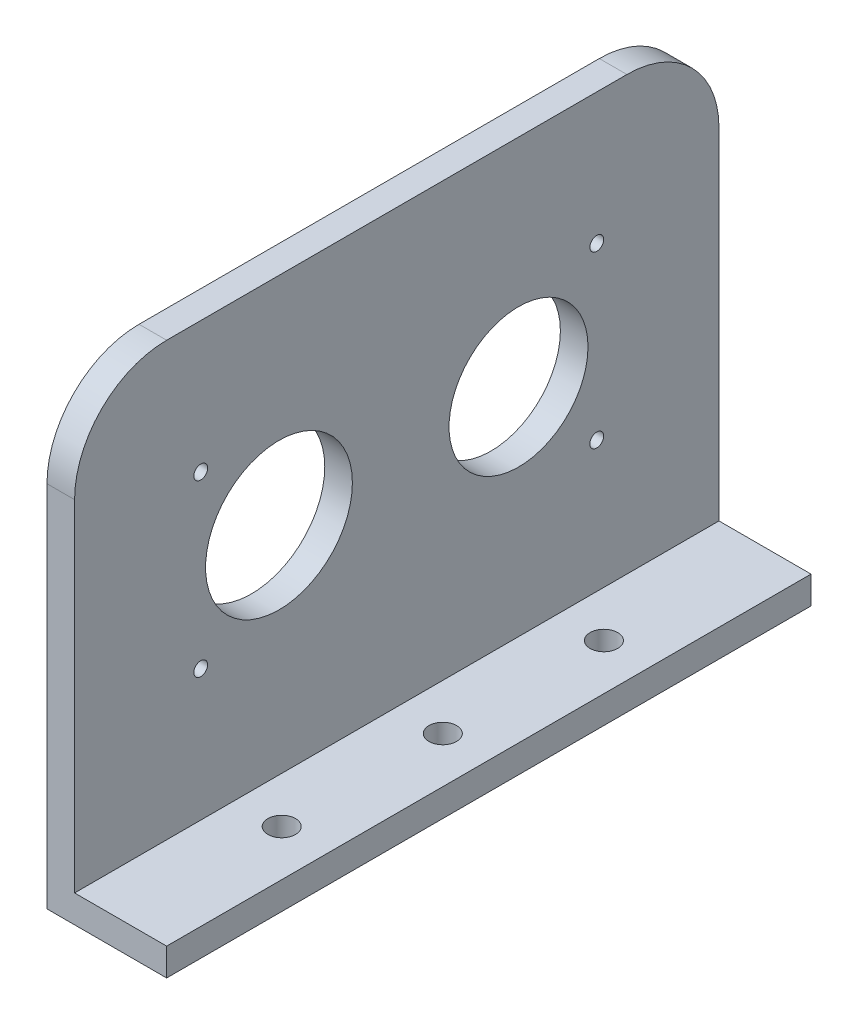
from build123d import *

# Parameters (mm, degrees)
BOSS_EXTRUDE1_DEPTH = 70
SKETCH2_R           = 7.975
CUT_EXTRUDE9_DEPTH  = 87.602540378
SKETCH2_12_R        = 7.5475
CUT_EXTRUDE10_DEPTH = 87.602540378
FILLET1_R           = 10
FILLET2_R           = 10
SKETCH3_R           = 1.5
CUT_EXTRUDE11_DEPTH = 86.311195045
SKETCH4_R           = 0.75
CUT_EXTRUDE12_DEPTH = 88


with BuildPart() as part:
    # Sketch1 → Boss-Extrude1 (new body)
    with BuildSketch(Plane.XY):
        Polygon((0, 0), (0, 3), (-10, 3), (-10, 50), (-13, 50), (-13, 0), align=None)
    extrude(amount=BOSS_EXTRUDE1_DEPTH)

    # Sketch2 → Cut-Extrude9 (cut, through all)
    with BuildSketch(Plane(origin=(-10, 0, 0), x_dir=(0, 0, -1), z_dir=(1, 0, 0))):
        with Locations((-47.7975, 26.5)):
            Circle(SKETCH2_R)
    extrude(amount=-CUT_EXTRUDE9_DEPTH, mode=Mode.SUBTRACT)

    # Sketch2<12> → Cut-Extrude10 (cut, through all)
    with BuildSketch(Plane(origin=(-10, 0, 0), x_dir=(0, 0, -1), z_dir=(1, 0, 0))):
        with Locations((-21.775, 26.5)):
            Circle(SKETCH2_12_R)
    extrude(amount=-CUT_EXTRUDE10_DEPTH, mode=Mode.SUBTRACT)

    # Fillet1
    fillet1_edges = [part.edges().sort_by_distance(p)[0] for p in [
        (-11.5, 50, 70),
    ]]
    fillet(fillet1_edges, radius=FILLET1_R)

    # Fillet2
    fillet2_edges = [part.edges().sort_by_distance(p)[0] for p in [
        (-11.5, 50, 0),
    ]]
    fillet(fillet2_edges, radius=FILLET2_R)

    # Sketch3 → Cut-Extrude11 (cut, through all)
    with BuildSketch(Plane(origin=(0, 3, 0), x_dir=(1, 0, 0), z_dir=(0, 1, 0))):
        with Locations((-5, -35)):
            Circle(SKETCH3_R)
        with Locations((-5, -52.5)):
            Circle(SKETCH3_R)
        with Locations((-5, -17.5)):
            Circle(SKETCH3_R)
    extrude(amount=-CUT_EXTRUDE11_DEPTH, mode=Mode.SUBTRACT)

    # Sketch4 → Cut-Extrude12 (cut, through all)
    with BuildSketch(Plane.ZY.offset(13)):
        with Locations((56.2975, 35.75)):
            Circle(SKETCH4_R)
        with Locations((13.275, 35.75)):
            Circle(SKETCH4_R)
        with Locations((13.275, 17.25)):
            Circle(SKETCH4_R)
        with Locations((56.2975, 17.25)):
            Circle(SKETCH4_R)
    extrude(amount=-CUT_EXTRUDE12_DEPTH, mode=Mode.SUBTRACT)


solid = part.part
